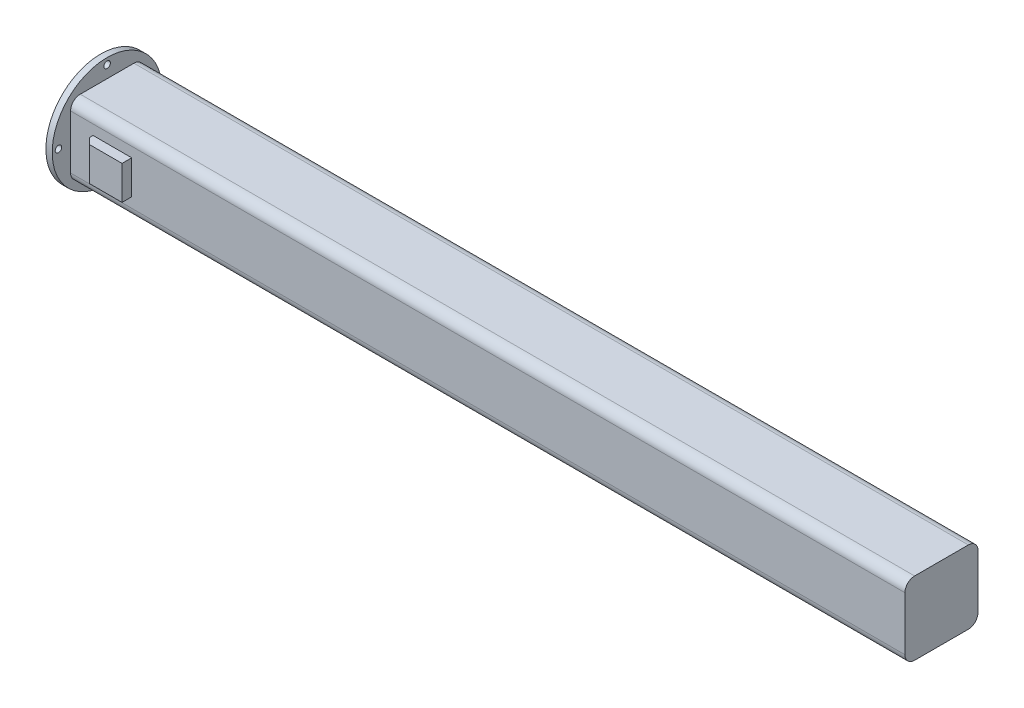
from build123d import *

# Parameters (mm, degrees)
SKETCH3_W                = 151
SKETCH3_H                = 151
BOSS_EXTRUDE2_DEPTH      = 1724.45
SKETCH4_R                = 113.5
BOSS_EXTRUDE3_DEPTH      = 13
SKETCH5_R                = 6.74624
CUT_EXTRUDE1_DEPTH       = 13
CIRPATTERN1_COUNT        = 4
FILLET1_R                = 20
SKETCH6_W                = 80
SKETCH6_H                = 69.85
BOSS_EXTRUDE4_DEPTH      = 20
CHAMFER1_SIZE            = 13
FILLET2_R                = 2
CHAMFER1_OF_MIRROR1_SIZE = 13
SHELL1_START             = -13
SHELL1_DEPTH             = 1732.45
SHELL1_START_2           = 61.471067812
SHELL1_2_OUTLINE_W       = 59.85
SHELL1_2_OUTLINE_H       = 20
SHELL1_2_DEPTH           = 59.928932188
SHELL1_3_DEPTH           = 8
SHELL1_START_3           = -29.925
SHELL1_4_DEPTH           = 59.85


with BuildPart() as part:
    # Sketch3 → Boss-Extrude2 (new body)
    with BuildSketch(Plane(origin=(0, 0, 0), x_dir=(0, 0, -1), z_dir=(1, 0, 0))):
        Rectangle(SKETCH3_W, SKETCH3_H)
    extrude(amount=BOSS_EXTRUDE2_DEPTH)

    # Sketch4 → Boss-Extrude3 (add)
    with BuildSketch(Plane.ZY):
        with Locations(Location((0, 0, 0), (0, 0, 180))):
            Circle(SKETCH4_R)
    extrude(amount=BOSS_EXTRUDE3_DEPTH)

    # Sketch5 → Cut-Extrude1 (cut)
    with BuildSketch(Plane(origin=(0, 0, 0), x_dir=(0, 0, -1), z_dir=(1, 0, 0))):
        with Locations((100.5, 0)):
            Circle(SKETCH5_R)
    cut_extrude1 = extrude(amount=-CUT_EXTRUDE1_DEPTH, mode=Mode.SUBTRACT)

    # CirPattern1: Cut-Extrude1 ×4 about axis
    cirpattern1_axis = Axis((0, 0, 0), (1, 0, 0))
    for i in range(1, CIRPATTERN1_COUNT):
        add(cut_extrude1.rotate(cirpattern1_axis, i * 360 / CIRPATTERN1_COUNT), mode=Mode.SUBTRACT)

    # Fillet1
    fillet1_edges = [part.edges().sort_by_distance(p)[0] for p in [
        (862.225, -75.5, -75.5),
        (862.225, -75.5, 75.5),
        (862.225, 75.5, 75.5),
        (862.225, 75.5, -75.5),
    ]]
    fillet(fillet1_edges, radius=FILLET1_R)

    # Sketch6 → Boss-Extrude4 (add)
    with BuildSketch(Plane(origin=(0, 0, -75.5), x_dir=(-1, 0, 0), z_dir=(0, 0, -1))):
        with Locations((-86.4, 0)):
            Rectangle(SKETCH6_W, SKETCH6_H)
    boss_extrude4 = extrude(amount=BOSS_EXTRUDE4_DEPTH)

    # Chamfer1
    chamfer1_edges = [part.edges().sort_by_distance(p)[0] for p in [
        (46.4, 0, -95.5),
    ]]
    chamfer(chamfer1_edges, length=CHAMFER1_SIZE)

    # Fillet2
    fillet2_edges = [part.edges().sort_by_distance(p)[0] for p in [
        (92.9, -34.925, -95.5),
        (92.9, 34.925, -95.5),
    ]]
    fillet(fillet2_edges, radius=FILLET2_R)

    # Mirror1: Boss-Extrude4 across plane
    add(boss_extrude4.mirror(Plane.XY))

    # Chamfer1 of Mirror1
    chamfer1_of_mirror1_edges = [part.edges().sort_by_distance(p)[0] for p in [
        (46.4, 0, 95.5),
    ]]
    chamfer(chamfer1_of_mirror1_edges, length=CHAMFER1_OF_MIRROR1_SIZE)

    # Shell1: read off the stored shape, not the designer's step
    # Shell1 outline → Shell1 (cut)
    with BuildSketch(Plane.YZ.offset(SHELL1_START)):
        with BuildLine():
            Line((55.5, 70.5), (-55.5, 70.5))
            ThreePointArc((-55.5, 70.5), (-66.106601718, 66.106601718), (-70.5, 55.5))
            Line((-70.5, 55.5), (-70.5, -55.5))
            ThreePointArc((-70.5, -55.5), (-66.106601718, -66.106601718), (-55.5, -70.5))
            Line((-55.5, -70.5), (55.5, -70.5))
            ThreePointArc((55.5, -70.5), (66.106601718, -66.106601718), (70.5, -55.5))
            Line((70.5, -55.5), (70.5, 55.5))
            ThreePointArc((70.5, 55.5), (66.106601718, 66.106601718), (55.5, 70.5))
        make_face()
    extrude(amount=SHELL1_DEPTH, mode=Mode.SUBTRACT)

    # Shell1 2 outline → Shell1 2 (cut)
    with BuildSketch(Plane.YZ.offset(SHELL1_START_2)):
        with Locations((0, 80.5)):
            Rectangle(SHELL1_2_OUTLINE_W, SHELL1_2_OUTLINE_H)
        with Locations((0, -80.5)):
            Rectangle(SHELL1_2_OUTLINE_W, SHELL1_2_OUTLINE_H)
    extrude(amount=SHELL1_2_DEPTH, mode=Mode.SUBTRACT)

    # Shell1 3 outline → Shell1 3 (cut)
    with BuildSketch(Plane.YZ.offset(SHELL1_START)):
        with BuildLine():
            ThreePointArc((108.131969382, -8.929008763), (88.75376, 0), (108.131969382, 8.929008763))
            ThreePointArc((108.131969382, 8.929008763), (76.721085759, 76.721085759), (8.929008763, 108.131969382))
            ThreePointArc((8.929008763, 108.131969382), (0, 88.75376), (-8.929008763, 108.131969382))
            ThreePointArc((-8.929008763, 108.131969382), (-76.721085759, 76.721085759), (-108.131969382, 8.929008763))
            ThreePointArc((-108.131969382, 8.929008763), (-88.75376, 0), (-108.131969382, -8.929008763))
            ThreePointArc((-108.131969382, -8.929008763), (-76.721085759, -76.721085759), (-8.929008763, -108.131969382))
            ThreePointArc((-8.929008763, -108.131969382), (0, -88.75376), (8.929008763, -108.131969382))
            ThreePointArc((8.929008763, -108.131969382), (76.721085759, -76.721085759), (108.131969382, -8.929008763))
        make_face()
        with BuildLine():
            Line((55.5, -70.5), (-55.5, -70.5))
            ThreePointArc((-55.5, -70.5), (-66.106601718, -66.106601718), (-70.5, -55.5))
            Line((-70.5, -55.5), (-70.5, 55.5))
            ThreePointArc((-70.5, 55.5), (-66.106601718, 66.106601718), (-55.5, 70.5))
            Line((-55.5, 70.5), (55.5, 70.5))
            ThreePointArc((55.5, 70.5), (66.106601718, 66.106601718), (70.5, 55.5))
            Line((70.5, 55.5), (70.5, -55.5))
            ThreePointArc((70.5, -55.5), (66.106601718, -66.106601718), (55.5, -70.5))
        make_face(mode=Mode.SUBTRACT)
    extrude(amount=SHELL1_3_DEPTH, mode=Mode.SUBTRACT)

    # Shell1 4 outline → Shell1 4 (cut)
    with BuildSketch(Plane(origin=(0, 0, 0), x_dir=(1, 0, 0), z_dir=(0, 1, 0)).offset(SHELL1_START_3)):
        Polygon((51.4, 80.428932188), (51.4, 70.5), (61.471067812, 70.5), (61.471067812, 90.5), align=None)
        Polygon((61.471067812, -70.5), (51.4, -70.5), (51.4, -80.428932188), (61.471067812, -90.5), align=None)
    extrude(amount=SHELL1_4_DEPTH, mode=Mode.SUBTRACT)


solid = part.part
